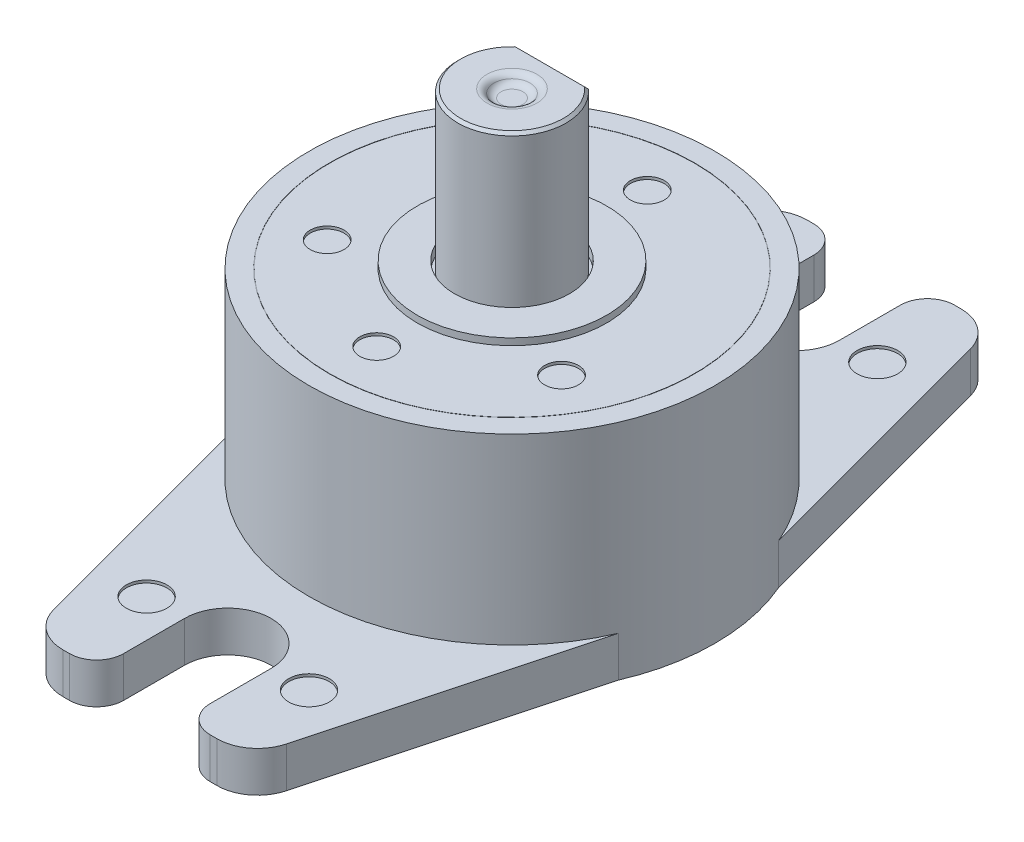
from build123d import *
from build123d.topology import SkipClean

# Parameters (mm, degrees)
SKETCH3_R           = 7.5
BOSS_EXTRUDE1_DEPTH = 1.5
SKETCH12_R          = 7.5
BOSS_EXTRUDE3_DEPTH = 7
CUT_EXTRUDE2_START  = -4.5
CUT_EXTRUDE2_DEPTH  = 4.5
CHAMFER1_SIZE       = 0.1
CUT_EXTRUDE3_START  = -0.25
SKETCH9_R           = 7.5
SKETCH9_R_2         = 3.5
CUT_EXTRUDE3_DEPTH  = 0.25
SKETCH13_R          = 0.625
CUT_EXTRUDE6_DEPTH  = 0.1
FILLET3_R           = 1.5
FILLET4_R           = 1
SKETCH10_R          = 0.75
CUT_EXTRUDE4_DEPTH  = 0.3
CUT_EXTRUDE4_DRAFT  = -30
SKETCH15_R          = 6.75
SKETCH15_R_2        = 6.74
CUT_EXTRUDE7_DEPTH  = 0.01
FILLET2_R           = 0.3
SKETCH11_R          = 0.75
CUT_EXTRUDE5_DEPTH  = 0.1


with BuildPart() as part:
    # Sketch3 → Boss-Extrude1 (new body)
    with BuildSketch(Plane(origin=(0, -7, -13.75), x_dir=(-1, 0, 0), z_dir=(0, -1, 0))):
        with BuildLine():
            Line((1.6, -27.5), (4, -27.5))
            Line((4, -27.5), (6.89115357, -16.710067986))
            ThreePointArc((6.89115357, -16.710067986), (0, -21.25), (-6.89115357, -16.710067986))
            Line((-6.89115357, -16.710067986), (-4, -27.5))
            Line((-4, -27.5), (-1.6, -27.5))
            Line((-1.6, -27.5), (-1.6, -24.25))
            ThreePointArc((-1.6, -24.25), (0, -22.65), (1.6, -24.25))
            Line((1.6, -24.25), (1.6, -27.5))
        make_face()
        with Locations((0, -13.75)):
            Circle(SKETCH3_R)
        with BuildLine():
            Line((-4, 0), (-6.89115357, -10.789932014))
            ThreePointArc((-6.89115357, -10.789932014), (0, -6.25), (6.89115357, -10.789932014))
            Line((6.89115357, -10.789932014), (4, 0))
            Line((4, 0), (1.6, 0))
            Line((1.6, 0), (1.6, -3.25))
            ThreePointArc((1.6, -3.25), (0, -4.85), (-1.6, -3.25))
            Line((-1.6, -3.25), (-1.6, 0))
            Line((-1.6, 0), (-4, 0))
        make_face()
    extrude(amount=-BOSS_EXTRUDE1_DEPTH)

    # Sketch12 → Boss-Extrude3 (add)
    with SkipClean():  # the faces are left unmerged after this step: merging them gives an invalid solid
        with BuildSketch(Plane(origin=(0, -5.5, 0), x_dir=(1, 0, 0), z_dir=(0, 1, 0))):
            with Locations(Location((0, 0, 0), (0, 0, 23.245751798))):
                Circle(SKETCH12_R)
        extrude(amount=BOSS_EXTRUDE3_DEPTH)
    add(part.part.scale(1), mode=Mode.REPLACE)  # the faces are merged on a copy

    # Sketch6 → Cut-Revolve1 (revolve, cut)
    with BuildSketch(Plane(origin=(0, 0, 0), x_dir=(0, 0, -1), z_dir=(1, 0, 0))):
        Polygon((0, -6.625), (-7.125, -6.625), (-7.125, 1.125), (-2.125, 1.125), (-2.125, 1.5), (0, 1.5), align=None)
    revolve(axis=Axis((0, 1.5, 0), (0, -1, 0)), mode=Mode.SUBTRACT)

    # Sketch9 → Cut-Extrude3 (cut)
    with BuildSketch(Plane(origin=(0, 1.5, 0), x_dir=(1, 0, 0), z_dir=(0, 1, 0)).offset(CUT_EXTRUDE3_START)):
        with Locations(Location((0, 0, 0), (0, 0, 23.245751798))):
            Circle(SKETCH9_R)
        with Locations(Location((0, 0, 0), (0, 0, 270))):
            Circle(SKETCH9_R_2, mode=Mode.SUBTRACT)
    extrude(amount=CUT_EXTRUDE3_DEPTH, mode=Mode.SUBTRACT)

    # Sketch13 → Cut-Extrude6 (cut)
    with BuildSketch(Plane(origin=(0, 1.25, 0), x_dir=(1, 0, 0), z_dir=(0, 1, 0))):
        with Locations(Location((0, 5, 0), (0, 0, 270))):
            Circle(SKETCH13_R)
        with Locations(Location((4.330127019, -2.5, 0), (0, 0, 270))):
            Circle(SKETCH13_R)
        with Locations(Location((-4.330127019, -2.5, 0), (0, 0, 270))):
            Circle(SKETCH13_R)
        with Locations(Location((0, -5, 0), (0, 0, 270))):
            Circle(SKETCH13_R)
    extrude(amount=-CUT_EXTRUDE6_DEPTH, mode=Mode.SUBTRACT)

    # Fillet3
    fillet3_edges = [part.edges().sort_by_distance(p)[0] for p in [
        (4, -6.25, 13.75),
        (4, -6.25, -13.75),
        (-4, -6.25, -13.75),
        (-4, -6.25, 13.75),
    ]]
    fillet(fillet3_edges, radius=FILLET3_R)

    # Fillet4
    fillet4_edges = [part.edges().sort_by_distance(p)[0] for p in [
        (1.6, -6.25, 13.75),
        (1.6, -6.25, -13.75),
        (-1.6, -6.25, -13.75),
        (-1.6, -6.25, 13.75),
    ]]
    fillet(fillet4_edges, radius=FILLET4_R)

    # Sketch15 → Cut-Extrude7 (cut)
    with BuildSketch(Plane(origin=(0, 1.25, 0), x_dir=(1, 0, 0), z_dir=(0, 1, 0))):
        with Locations(Location((0, 0, 0), (0, 0, 270))):
            Circle(SKETCH15_R)
        with Locations(Location((0, 0, 0), (0, 0, 270))):
            Circle(SKETCH15_R_2, mode=Mode.SUBTRACT)
    extrude(amount=-CUT_EXTRUDE7_DEPTH, mode=Mode.SUBTRACT)

    # Sketch11 → Cut-Extrude5 (cut)
    with BuildSketch(Plane(origin=(0, -5.5, 0), x_dir=(1, 0, 0), z_dir=(0, 1, 0))):
        with Locations(Location((3, 10.5, 0), (0, 0, 270))):
            Circle(SKETCH11_R)
        with Locations(Location((-3, 10.5, 0), (0, 0, 270))):
            Circle(SKETCH11_R)
        with Locations(Location((3, -10.5, 0), (0, 0, 270))):
            Circle(SKETCH11_R)
        with Locations(Location((-3, -10.5, 0), (0, 0, 270))):
            Circle(SKETCH11_R)
    extrude(amount=-CUT_EXTRUDE5_DEPTH, mode=Mode.SUBTRACT)

    # Sketch16 → Cut-Revolve2 (revolve, cut)
    with BuildSketch(Plane(origin=(0, 0, 0), x_dir=(0, 0, -1), z_dir=(1, 0, 0))):
        with BuildLine():
            Line((0, -7), (0, -6.9))
            ThreePointArc((0, -6.9), (-0.254950976, -6.925245122), (-0.5, -7))
            Line((-0.5, -7), (0, -7))
        make_face()
    revolve(axis=Axis((0, -7, 0), (0, 1, 0)), mode=Mode.SUBTRACT)


with BuildPart() as body_2:
    # Sketch7 → Revolve1 (revolve)
    with BuildSketch(Plane(origin=(0, 0, 0), x_dir=(0, 0, -1), z_dir=(1, 0, 0))):
        Polygon((0, 7), (0, -6.625), (-7.125, -6.625), (-7.125, 1.125), (-2, 1.125), (-2, 7), align=None)
    revolve(axis=Axis((0, 7, 0), (0, -1, 0)))

    # Sketch8 → Cut-Extrude2 (cut)
    with BuildSketch(Plane(origin=(0, 7, 0), x_dir=(1, 0, 0), z_dir=(0, 1, 0)).offset(CUT_EXTRUDE2_START)):
        Polygon((-46.559540358, 1.5), (-1.322875656, 1.5), (1.322875656, 1.5), (46.559540358, 1.5), (46.559540358, 91.973329404), (-46.559540358, 91.973329404), align=None)
    extrude(amount=CUT_EXTRUDE2_DEPTH, mode=Mode.SUBTRACT)

    # Chamfer1
    chamfer1_edges = [body_2.edges().sort_by_distance(p)[0] for p in [
        (1.870828693, 7, 0.707106781),
        (0, 7, -1.5),
    ]]
    chamfer(chamfer1_edges, length=CHAMFER1_SIZE)


with BuildPart() as cut_extrude4_tool:
    # Sketch10 → Cut-Extrude4 (with draft: the straight prism first)
    with BuildSketch(Plane(origin=(0, 7, 0), x_dir=(1, 0, 0), z_dir=(0, 1, 0))):
        Circle(SKETCH10_R)
    extrude(amount=-CUT_EXTRUDE4_DEPTH)
    # Cut-Extrude4: the draft: its side faces are tilted about the plane it starts from
    cut_extrude4_sides = [cut_extrude4_tool.faces().sort_by_distance(p)[0] for p in [
        (-0.75, 6.85, 0),
    ]]
    draft(cut_extrude4_sides, Plane(origin=(0, 7, 0), x_dir=(1, 0, 0), z_dir=(0, 1, 0)), CUT_EXTRUDE4_DRAFT)


with BuildPart() as body_2_1:
    add(body_2.part)

    # Cut-Extrude4: cut by cut_extrude4_tool
    add(cut_extrude4_tool.part, mode=Mode.SUBTRACT)

    # Fillet2
    fillet2_edges = [body_2_1.edges().sort_by_distance(p)[0] for p in [
        (-0.576794919, 6.7, 0),
        (-0.75, 7, 0),
    ]]
    fillet(fillet2_edges, radius=FILLET2_R - 0.0001)  # a hair under: the kernel refuses the full size


solid = Compound([part.part, body_2_1.part])
